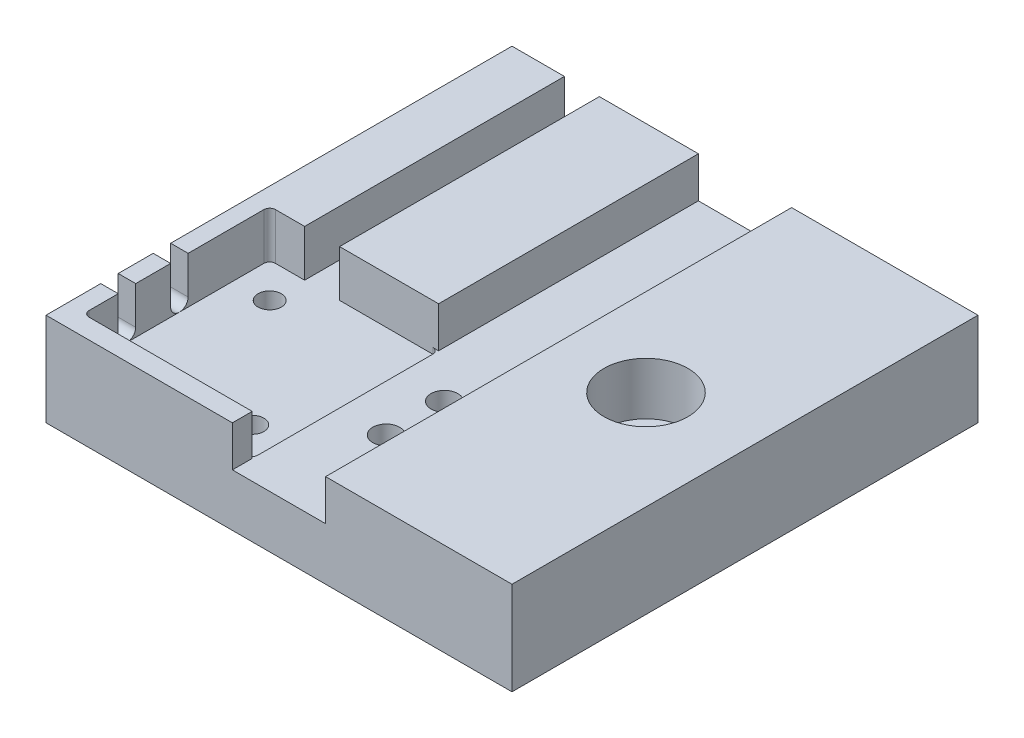
from build123d import *

# Parameters (mm, degrees)
SKETCH_1_W           = 40
SKETCH_1_H           = 40
EXTRUDE_1_DEPTH      = 8
SKETCH_2_W           = 8
SKETCH_2_H           = 40
CUT_EXTRUDE_1_DEPTH  = 3.5
SKETCH_3_R           = 1.15
CUT_EXTRUDE_2_DEPTH  = 58.131427428
SKETCH_4_R           = 2
CUT_EXTRUDE_3_DEPTH  = 2.4
SKETCH_5_W           = 14.5
SKETCH_5_H           = 16
CUT_EXTRUDE_4_DEPTH  = 4
FILLET_2_R           = 0.5
SKETCH_6_W           = 1.5
SKETCH_6_H           = 1.5
CUT_EXTRUDE_5_DEPTH  = 4
SKETCH_7_R           = 1
CUT_EXTRUDE_6_DEPTH  = 4
FILLET_3_R           = 0.75
FILLET_4_R           = 0.75
CUT_EXTRUDE_7_DEPTH  = 4
SKETCH_10_R          = 3.6
CUT_EXTRUDE_9_DEPTH  = 4.5
SKETCH_11_R          = 2.1
CUT_EXTRUDE_10_DEPTH = 57.747246629


with BuildPart() as part:
    # 草图1 → 凸台-拉伸1 (new body)
    with BuildSketch(Plane(origin=(0, 0, 0), x_dir=(1, 0, 0), z_dir=(0, 1, 0))):
        with Locations((20, -20)):
            Rectangle(SKETCH_1_W, SKETCH_1_H)
    extrude(amount=EXTRUDE_1_DEPTH)

    # 草图2 → 切除-拉伸1 (cut)
    with BuildSketch(Plane(origin=(0, 8, 0), x_dir=(1, 0, 0), z_dir=(0, 1, 0))):
        with Locations((20, -20)):
            Rectangle(SKETCH_2_W, SKETCH_2_H)
    extrude(amount=-CUT_EXTRUDE_1_DEPTH, mode=Mode.SUBTRACT)

    # 草图3 → 切除-拉伸2 (cut, through all)
    with BuildSketch(Plane(origin=(0, 0, 0), x_dir=(-1, 0, 0), z_dir=(0, -1, 0))):
        with Locations(Location((-20, -30.8, 0), (0, 0, 90))):
            Circle(SKETCH_3_R)
        with Locations(Location((-20, -25.8, 0), (0, 0, 90))):
            Circle(SKETCH_3_R)
    extrude(amount=-CUT_EXTRUDE_2_DEPTH, mode=Mode.SUBTRACT)

    # 草图4 → 切除-拉伸3 (cut)
    with BuildSketch(Plane(origin=(0, 0, 0), x_dir=(-1, 0, 0), z_dir=(0, -1, 0))):
        with Locations(Location((-20, -30.8, 0), (0, 0, 90))):
            Circle(SKETCH_4_R)
        with Locations(Location((-20, -25.8, 0), (0, 0, 90))):
            Circle(SKETCH_4_R)
    extrude(amount=-CUT_EXTRUDE_3_DEPTH, mode=Mode.SUBTRACT)

    # 草图5 → 切除-拉伸4 (cut)
    with BuildSketch(Plane(origin=(0, 8, 0), x_dir=(1, 0, 0), z_dir=(0, 1, 0))):
        with Locations((8.75, -30.3)):
            Rectangle(SKETCH_5_W, SKETCH_5_H)
    extrude(amount=-CUT_EXTRUDE_4_DEPTH, mode=Mode.SUBTRACT)

    # 圆角2
    fillet_2_edges = [part.edges().sort_by_distance(p)[0] for p in [
        (16, 4.25, 22.3),
        (16, 4.25, 38.3),
        (1.5, 6, 38.3),
        (1.5, 6, 22.3),
    ]]
    fillet(fillet_2_edges, radius=FILLET_2_R)

    # 草图6 → 切除-拉伸5 (cut)
    with BuildSketch(Plane(origin=(0, 8, 0), x_dir=(1, 0, 0), z_dir=(0, 1, 0))):
        with Locations((0.75, -34.55)):
            Rectangle(SKETCH_6_W, SKETCH_6_H)
        with Locations((0.75, -30.05)):
            Rectangle(SKETCH_6_W, SKETCH_6_H)
    extrude(amount=-CUT_EXTRUDE_5_DEPTH, mode=Mode.SUBTRACT)

    # 草图7 → 切除-拉伸6 (cut)
    with BuildSketch(Plane(origin=(0, 4, 0), x_dir=(1, 0, 0), z_dir=(0, 1, 0))):
        with Locations(Location((4.5, -25.3, 0), (0, 0, 270))):
            Circle(SKETCH_7_R)
        with Locations(Location((13, -35.3, 0), (0, 0, 270))):
            Circle(SKETCH_7_R)
    extrude(amount=-CUT_EXTRUDE_6_DEPTH, mode=Mode.SUBTRACT)

    # 圆角3
    # the kernel refuses this fillet: 0.75 mm, written as the material it adds along each edge
    with BuildSketch(Plane(origin=(0, 4, 29.3), x_dir=(0, 0, 1), z_dir=(1, 0, 0)), Plane(origin=(1.5, 4, 30.8), x_dir=(0, 0, -1), z_dir=(-1, 0, 0))) as fillet_3_piece_1:
        with BuildLine():
            CenterArc((FILLET_3_R, -FILLET_3_R), FILLET_3_R, 90, 90)
            Line((0, -FILLET_3_R), (0, 0))
            Line((0, 0), (FILLET_3_R, 0))
        make_face()
    extrude(amount=1.5)

    # 圆角4
    # the kernel refuses this fillet: 0.75 mm, written as the material it adds along each edge
    with BuildSketch(Plane(origin=(0, 4, 33.8), x_dir=(0, 0, 1), z_dir=(1, 0, 0)), Plane(origin=(1.5, 4, 35.3), x_dir=(0, 0, -1), z_dir=(-1, 0, 0))) as fillet_4_piece_1:
        with BuildLine():
            CenterArc((FILLET_4_R, -FILLET_4_R), FILLET_4_R, 90, 90)
            Line((0, -FILLET_4_R), (0, 0))
            Line((0, 0), (FILLET_4_R, 0))
        make_face()
    extrude(amount=1.5)

    # 草图8 → 切除-拉伸7 (cut)
    with BuildSketch(Plane(origin=(0, 8, 0), x_dir=(1, 0, 0), z_dir=(0, 1, 0))):
        with BuildLine():
            Line((7.5, 0.415504674), (7.5, -29.155940237))
            ThreePointArc((7.5, -29.155940237), (6, -30.655940237), (4.5, -29.155940237))
            Line((4.5, -29.155940237), (4.5, 0.415504674))
            ThreePointArc((4.5, 0.415504674), (6, 1.915504674), (7.5, 0.415504674))
        make_face()
    extrude(amount=-CUT_EXTRUDE_7_DEPTH, mode=Mode.SUBTRACT)

    # 草图10 → 切除-拉伸9 (cut)
    with BuildSketch(Plane(origin=(0, 8, 0), x_dir=(1, 0, 0), z_dir=(0, 1, 0))):
        with Locations(Location((31.5, -20, 0), (0, 0, 270))):
            Circle(SKETCH_10_R)
    extrude(amount=-CUT_EXTRUDE_9_DEPTH, mode=Mode.SUBTRACT)

    # 草图11 → 切除-拉伸10 (cut, through all)
    with BuildSketch(Plane(origin=(0, 3.5, 0), x_dir=(1, 0, 0), z_dir=(0, 1, 0))):
        with Locations(Location((31.5, -20, 0), (0, 0, 270))):
            Circle(SKETCH_11_R)
    extrude(amount=-CUT_EXTRUDE_10_DEPTH, mode=Mode.SUBTRACT)


solid = part.part
